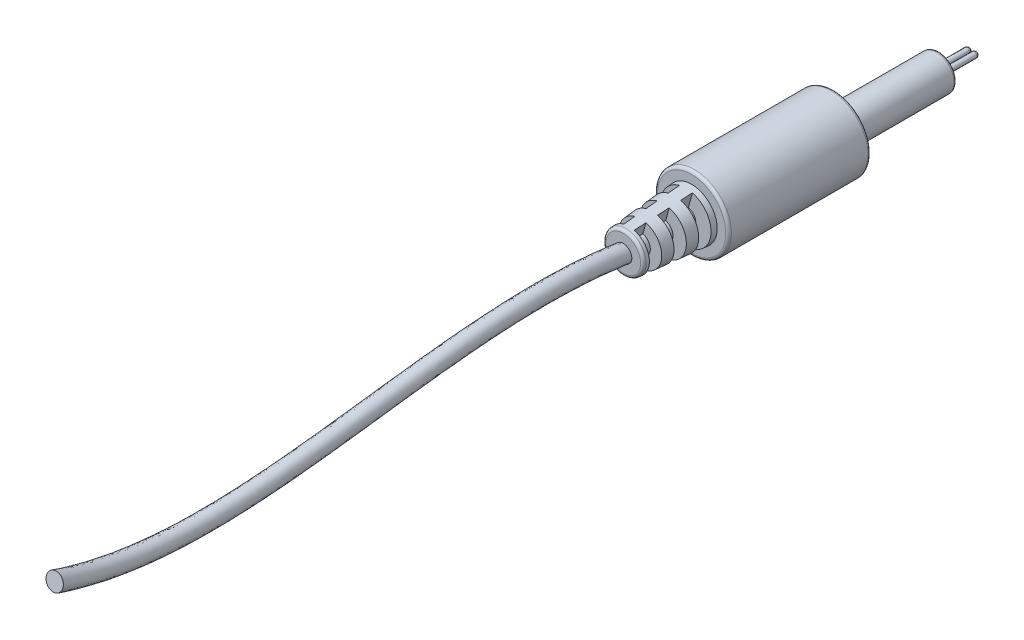
from build123d import *

# Parameters (mm, degrees)
SKETCH3_R            = 0.5
BOSS_EXTRUDE1_DEPTH  = 6
FILLET1_R            = 0.5
SKETCH4_R            = 1.5
CUT_REVOLVE1_START   = -11
CUT_REVOLVE1_DEPTH   = 2
CUT_REVOLVE1_START_2 = -7
CUT_REVOLVE1_2_DEPTH = 2
CUT_REVOLVE1_START_3 = -3
CUT_REVOLVE1_3_DEPTH = 2


# Read off the part's stored shape, not the designer's step: Cut-Revolve1
with BuildPart() as part:
    # Sketch2 → Revolve1 (revolve)
    with BuildSketch(Plane(origin=(0, 0, 0), x_dir=(1, 0, 0), z_dir=(0, 1, 0))):
        Polygon((0, 0), (3.5, 0), (4.5, 12), (6.5, 12), (6.5, 37), (3.1, 37), (3.1, 55.5), (0, 55.5), align=None)
    revolve(axis=Axis((0, 0, 0), (0, 0, -1)))

    # Sketch3 → Boss-Extrude1 (add)
    with BuildSketch(Plane(origin=(0, 0, -55.5), x_dir=(-1, 0, 0), z_dir=(0, 0, -1))):
        with Locations((0.625, 0)):
            Circle(SKETCH3_R)
        with Locations((-0.625, 0)):
            Circle(SKETCH3_R)
    extrude(amount=BOSS_EXTRUDE1_DEPTH)

    # Fillet1
    fillet1_edges = [part.edges().sort_by_distance(p)[0] for p in [
        (-0.125, 0, -61.5),
        (1.125, 0, -61.5),
        (-3.1, 0, -55.5),
        (-6.5, 0, -37),
        (-6.5, 0, -12),
        (-3.5, 0, 0),
    ]]
    fillet(fillet1_edges, radius=FILLET1_R)

    # Sweep1: sweep along a path in Sketch5
    with BuildLine() as sweep1_path:  # in the path sketch's own coordinates; laid on its plane below (add() does not lay a ready-made edge on the line's plane)
        add(Edge.make_bspline(
            [(0, 0), (-33.560093423, 5.11444516), (-66.780805362, -11.20288957), (-99.919950145, 0)],
            knots=[0, 0, 0, 0, 1, 1, 1, 1], degree=3))
    # Sketch4 → Sweep1 (sweep)
    with BuildSketch(Plane.XY):
        Circle(SKETCH4_R)
    sweep(path=Plane(origin=(0, 0, 0), x_dir=(0, 0, -1), z_dir=(1, 0, 0)) * sweep1_path.line)

    # Cut-Revolve1 outline → Cut-Revolve1 (cut)
    with BuildSketch(Plane.XY.offset(CUT_REVOLVE1_START)):
        with BuildLine():
            ThreePointArc((0.452933329, 1.690370196), (1.75, 0), (0.452933329, -1.690370196))
            Line((0.452933329, -1.690370196), (0.970571419, -3.622221849))
            Line((0.970571419, -3.622221849), (1.056844434, -3.944197124))
            Line((1.056844434, -3.944197124), (1.143117449, -4.266172399))
            Line((1.143117449, -4.266172399), (1.607695154, -6))
            Line((1.607695154, -6), (6, -6))
            Line((6, -6), (6, 6))
            Line((6, 6), (1.607695154, 6))
            Line((1.607695154, 6), (1.143117449, 4.266172399))
            Line((1.143117449, 4.266172399), (1.056844434, 3.944197124))
            Line((1.056844434, 3.944197124), (0.970571419, 3.622221849))
            Line((0.970571419, 3.622221849), (0.452933329, 1.690370196))
        make_face()
    cut_revolve1 = extrude(amount=CUT_REVOLVE1_DEPTH, mode=Mode.SUBTRACT)

    # Cut-Revolve1 2 outline → Cut-Revolve1 2 (cut)
    with BuildSketch(Plane.XY.offset(CUT_REVOLVE1_START_2)):
        with BuildLine():
            ThreePointArc((0.452933329, 1.690370196), (1.75, 0), (0.452933329, -1.690370196))
            Line((0.452933329, -1.690370196), (0.970571419, -3.622221849))
            Line((0.970571419, -3.622221849), (1.056844434, -3.944197124))
            Line((1.056844434, -3.944197124), (1.143117449, -4.266172399))
            Line((1.143117449, -4.266172399), (1.607695154, -6))
            Line((1.607695154, -6), (6, -6))
            Line((6, -6), (6, 6))
            Line((6, 6), (1.607695154, 6))
            Line((1.607695154, 6), (1.143117449, 4.266172399))
            Line((1.143117449, 4.266172399), (1.056844434, 3.944197124))
            Line((1.056844434, 3.944197124), (0.970571419, 3.622221849))
            Line((0.970571419, 3.622221849), (0.452933329, 1.690370196))
        make_face()
    cut_revolve1_2 = extrude(amount=CUT_REVOLVE1_2_DEPTH, mode=Mode.SUBTRACT)

    # Cut-Revolve1 3 outline → Cut-Revolve1 3 (cut)
    with BuildSketch(Plane.XY.offset(CUT_REVOLVE1_START_3)):
        with BuildLine():
            ThreePointArc((0.452933329, 1.690370196), (1.75, 0), (0.452933329, -1.690370196))
            Line((0.452933329, -1.690370196), (0.970571419, -3.622221849))
            Line((0.970571419, -3.622221849), (1.056844434, -3.944197124))
            Line((1.056844434, -3.944197124), (1.143117449, -4.266172399))
            Line((1.143117449, -4.266172399), (1.607695154, -6))
            Line((1.607695154, -6), (6, -6))
            Line((6, -6), (6, 6))
            Line((6, 6), (1.607695154, 6))
            Line((1.607695154, 6), (1.143117449, 4.266172399))
            Line((1.143117449, 4.266172399), (1.056844434, 3.944197124))
            Line((1.056844434, 3.944197124), (0.970571419, 3.622221849))
            Line((0.970571419, 3.622221849), (0.452933329, 1.690370196))
        make_face()
    cut_revolve1_3 = extrude(amount=CUT_REVOLVE1_3_DEPTH, mode=Mode.SUBTRACT)

    # Mirror1: Cut-Revolve1, Cut-Revolve1 2, Cut-Revolve1 3 across plane
    add(cut_revolve1.mirror(Plane(origin=(0, 0, 0), x_dir=(0, 0, 1), z_dir=(1, 0, 0))), mode=Mode.SUBTRACT)
    add(cut_revolve1_2.mirror(Plane(origin=(0, 0, 0), x_dir=(0, 0, 1), z_dir=(1, 0, 0))), mode=Mode.SUBTRACT)
    add(cut_revolve1_3.mirror(Plane(origin=(0, 0, 0), x_dir=(0, 0, 1), z_dir=(1, 0, 0))), mode=Mode.SUBTRACT)


solid = part.part
